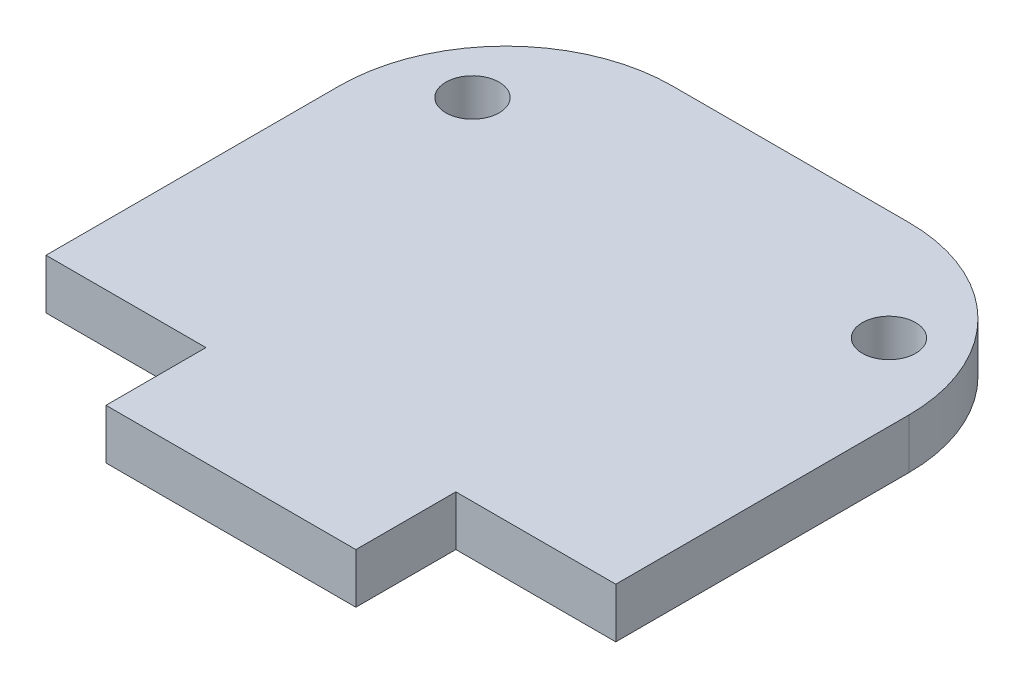
from build123d import *

# Parameters (mm, degrees)
ESBO_O1_R                = 1.6
RESSALTO_EXTRUS_O1_DEPTH = 3


with BuildPart() as part:
    # Esboço1 → Ressalto-extrusão1 (new body)
    with BuildSketch(Plane.XZ.offset(3)):
        with BuildLine():
            Line((-7.1, -33.6), (7.1, -33.6))
            ThreePointArc((7.1, -33.6), (14.171067812, -30.671067812), (17.1, -23.6))
            Line((17.1, -23.6), (17.1, -6))
            Line((17.1, -6), (7.5, -6))
            Line((7.5, -6), (7.5, 0))
            Line((7.5, 0), (-7.5, 0))
            Line((-7.5, 0), (-7.5, -6))
            Line((-7.5, -6), (-17.1, -6))
            Line((-17.1, -6), (-17.1, -23.6))
            ThreePointArc((-17.1, -23.6), (-14.171067812, -30.671067812), (-7.1, -33.6))
        make_face()
        with Locations((-12.5, -27)):
            Circle(ESBO_O1_R, mode=Mode.SUBTRACT)
        with Locations((12.5, -27)):
            Circle(ESBO_O1_R, mode=Mode.SUBTRACT)
    extrude(amount=-RESSALTO_EXTRUS_O1_DEPTH)


solid = part.part
